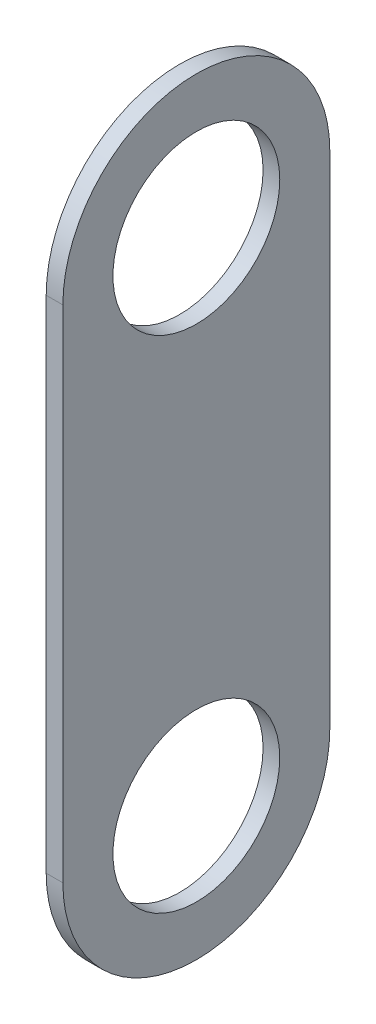
from build123d import *

# Parameters (mm, degrees)
SKETCH1_R          = 2.5
BASE_FLANGE1_DEPTH = 0.5


# Sheet-metal steps are written as plain solids
with BuildPart() as part:
    # Sketch1 → Base-Flange1 (new body)
    with BuildSketch(Plane(origin=(0, 0, 0), x_dir=(0, 0, -1), z_dir=(1, 0, 0))):
        with BuildLine():
            Line((-4, -7.5), (-4, 7.5))
            ThreePointArc((-4, 7.5), (0, 11.5), (4, 7.5))
            Line((4, 7.5), (4, -7.5))
            ThreePointArc((4, -7.5), (0, -11.5), (-4, -7.5))
        make_face()
        with Locations((0, 7.5)):
            Circle(SKETCH1_R, mode=Mode.SUBTRACT)
        with Locations((0, -7.5)):
            Circle(SKETCH1_R, mode=Mode.SUBTRACT)
    extrude(amount=-BASE_FLANGE1_DEPTH)


solid = part.part
